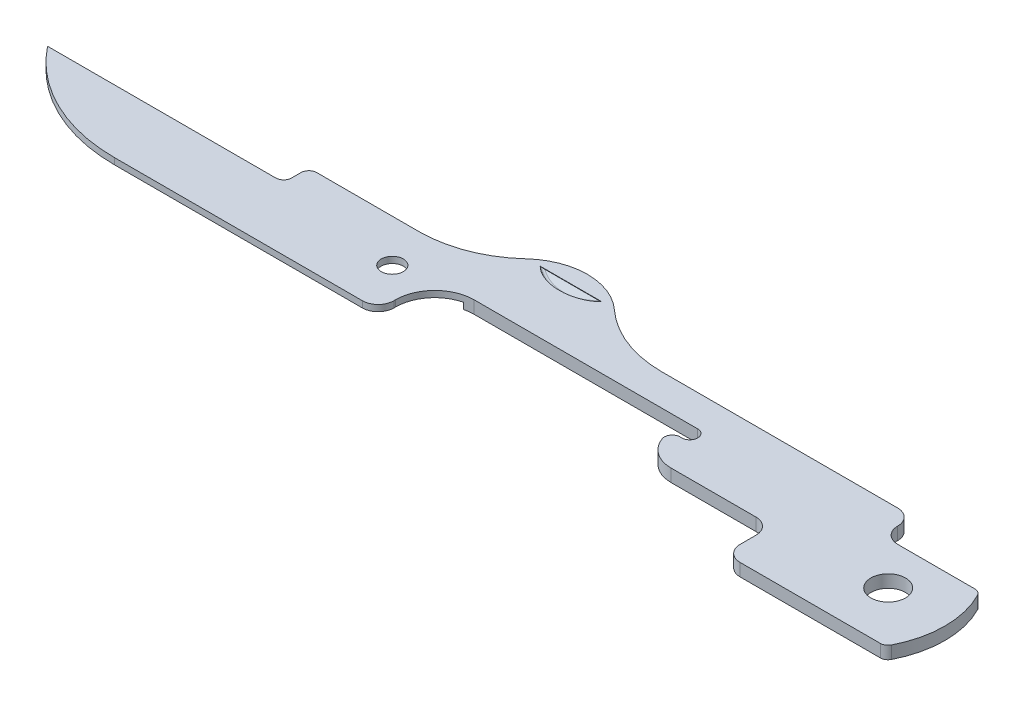
from build123d import *

# Parameters (mm, degrees)
BOSS_EXTRUDE1_DEPTH    = 1.016
CUT_EXTRUDE1_DEPTH     = 78.144111272
FILLET1_R              = 0.635
FILLET2_R              = 1.27
FILLET3_R              = 0.635
SKETCH3_R              = 1.397
CUT_EXTRUDE2_DEPTH     = 78.144111272
CUT_EXTRUDE3_DEPTH     = 0.360211591
CUT_EXTRUDE3_TAPER     = 20
FILLET4_R              = 0.254
FILLET5_R              = 3.175
SKETCH5_R              = 0.889
CUT_EXTRUDE4_DEPTH     = 78.144111382
CUT_EXTRUDE5_OUTLINE_W = 0.508
CUT_EXTRUDE5_OUTLINE_H = 11.08
CUT_EXTRUDE5_DEPTH     = 34.163


# Read off the part's stored shape, not the designer's step: Cut-Extrude3, Cut-Extrude5
with BuildPart() as part:
    # Sketch1 → Boss-Extrude1 (new body)
    with BuildSketch(Plane(origin=(0, 0, 0), x_dir=(1, 0, 0), z_dir=(0, 1, 0))):
        with BuildLine():
            Line((0, 0), (19.05, 0))
            Line((19.05, 0), (19.05, 2.032))
            Line((19.05, 2.032), (27.94, 2.032))
            ThreePointArc((27.94, 2.032), (31.279316908, 2.659542662), (34.163, 4.456545455))
            ThreePointArc((34.163, 4.456545455), (37.719, 5.842), (41.275, 4.456545455))
            ThreePointArc((41.275, 4.456545455), (44.158683092, 2.659542662), (47.498, 2.032))
            Line((47.498, 2.032), (67.818, 2.032))
            Line((67.818, 2.032), (67.818, -0.508))
            Line((67.818, -0.508), (75.687113577, -0.508))
            ThreePointArc((75.687113577, -0.508), (76.708, -4.318), (75.687113577, -8.128))
            Line((75.687113577, -8.128), (62.738, -8.128))
            Line((62.738, -8.128), (62.738, -4.318))
            Line((62.738, -4.318), (54.61, -4.318))
            ThreePointArc((54.61, -4.318), (52.813948776, -3.574051224), (52.07, -1.778))
            Line((52.07, -1.778), (52.07, -0.508))
            Line((52.07, -0.508), (31.75, -0.508))
            Line((31.75, -0.508), (31.75, -5.08))
            Line((31.75, -5.08), (10.472688289, -5.08))
            ThreePointArc((10.472688289, -5.08), (4.652817156, -3.742971704), (0, 0))
        make_face()
    extrude(amount=BOSS_EXTRUDE1_DEPTH)

    # Sketch2 → Cut-Extrude1 (cut, through all)
    with BuildSketch(Plane(origin=(0, 1.016, 0), x_dir=(1, 0, 0), z_dir=(0, 1, 0))):
        with BuildLine():
            Line((52.959, -1.778), (52.07, -1.778))
            Line((52.07, -1.778), (52.07, -0.508))
            Line((52.07, -0.508), (52.959, -0.508))
            ThreePointArc((52.959, -0.508), (53.594, -1.143), (52.959, -1.778))
        make_face()
    extrude(amount=-CUT_EXTRUDE1_DEPTH, mode=Mode.SUBTRACT)

    # Fillet1
    fillet1_edges = [part.edges().sort_by_distance(p)[0] for p in [
        (52.07, 0.508, 1.778),
    ]]
    fillet(fillet1_edges, radius=FILLET1_R)

    # Fillet2
    fillet2_edges = [part.edges().sort_by_distance(p)[0] for p in [
        (67.818, 0.508, 0.508),
        (67.818, 0.508, -2.032),
        (62.738, 0.508, 8.128),
        (62.738, 0.508, 4.318),
        (31.75, 0.508, 5.08),
    ]]
    fillet(fillet2_edges, radius=FILLET2_R - 0.0001)  # a hair under: the kernel refuses the full size

    # Fillet3
    fillet3_edges = [part.edges().sort_by_distance(p)[0] for p in [
        (19.05, 0.508, 0),
        (19.05, 0.508, -2.032),
        (75.687113577, 0.508, 0.508),
        (75.687113577, 0.508, 8.128),
    ]]
    fillet(fillet3_edges, radius=FILLET3_R)

    # Sketch3 → Cut-Extrude2 (cut, through all)
    with BuildSketch(Plane(origin=(0, 1.016, 0), x_dir=(1, 0, 0), z_dir=(0, 1, 0))):
        with Locations(Location((71.755, -3.937, 0), (0, 0, 270))):
            Circle(SKETCH3_R)
    extrude(amount=-CUT_EXTRUDE2_DEPTH, mode=Mode.SUBTRACT)

    # Cut-Extrude3 outline → Cut-Extrude3 (cut)
    with BuildSketch(Plane(origin=(0, -0.296094575, -0.079338302), x_dir=(-1, 0, 0), z_dir=(0, 0.9659258262890681, 0.25881904510252135))):
        with BuildLine():
            ThreePointArc((-34.967158874, -4.659244146), (-37.719, -3.594110297), (-40.470841126, -4.659244146))
            Line((-40.470841126, -4.659244146), (-34.967158874, -4.659244146))
        make_face()
    extrude(amount=CUT_EXTRUDE3_DEPTH, taper=CUT_EXTRUDE3_TAPER, mode=Mode.SUBTRACT)

    # Fillet4
    fillet4_edges = [part.edges().sort_by_distance(p)[0] for p in [
        (37.719, 0.63412962, -3.55098226),
    ]]
    fillet(fillet4_edges, radius=FILLET4_R - 0.0001)  # a hair under: the kernel refuses the full size

    # Fillet5
    fillet5_edges = [part.edges().sort_by_distance(p)[0] for p in [
        (31.75, 0.508, 0.508),
    ]]
    fillet(fillet5_edges, radius=FILLET5_R)

    # Sketch5 → Cut-Extrude4 (cut, through all)
    with BuildSketch(Plane(origin=(0, 1.016, 0), x_dir=(1, 0, 0), z_dir=(0, 1, 0))):
        with Locations(Location((29.21, -1.397, 0), (0, 0, 270))):
            Circle(SKETCH5_R)
    extrude(amount=-CUT_EXTRUDE4_DEPTH, mode=Mode.SUBTRACT)

    # Cut-Extrude5 outline → Cut-Extrude5 (cut)
    with BuildSketch(Plane.YZ):
        with Locations((0.254, -0.46)):
            Rectangle(CUT_EXTRUDE5_OUTLINE_W, CUT_EXTRUDE5_OUTLINE_H)
    extrude(amount=CUT_EXTRUDE5_DEPTH, mode=Mode.SUBTRACT)


solid = part.part
